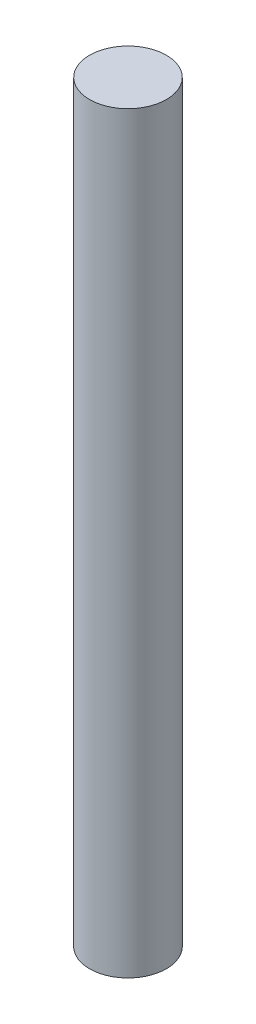
from build123d import *

# Parameters (mm, degrees)
SKETCH1_R           = 5
BOSS_EXTRUDE1_DEPTH = 98


with BuildPart() as part:
    # Sketch1 → Boss-Extrude1 (new body)
    with BuildSketch(Plane(origin=(0, 0, 0), x_dir=(1, 0, 0), z_dir=(0, 1, 0))):
        Circle(SKETCH1_R)
    extrude(amount=BOSS_EXTRUDE1_DEPTH)


solid = part.part
